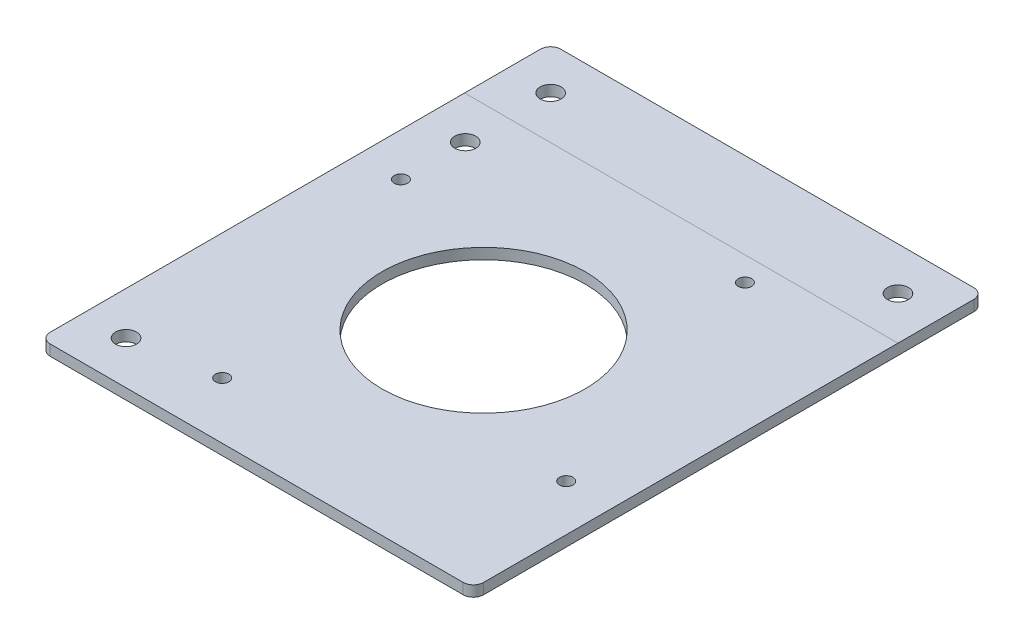
from build123d import *

# Parameters (mm, degrees)
SKETCH1_W           = 128
SKETCH1_H           = 150.8
SKETCH1_R           = 30
SKETCH1_R_2         = 3.1
BOSS_EXTRUDE1_DEPTH = 3.175
FILLET1_R           = 3
SKETCH3_R           = 1.985
CUT_EXTRUDE1_DEPTH  = 637.61018671


with BuildPart() as part:
    # Sketch1 → Boss-Extrude1 (new body)
    with BuildSketch(Plane(origin=(0, 0, 0), x_dir=(1, 0, 0), z_dir=(0, 1, 0))):
        with Locations((77.127334094, -545.362051651)):
            Rectangle(SKETCH1_W, SKETCH1_H)
        with Locations((76.627334094, -553.262051651)):
            Circle(SKETCH1_R, mode=Mode.SUBTRACT)
        with Locations((25.827334094, -482.662051651)):
            Circle(SKETCH1_R_2, mode=Mode.SUBTRACT)
        with Locations((128.427334094, -482.662051651)):
            Circle(SKETCH1_R_2, mode=Mode.SUBTRACT)
        with Locations((25.827334094, -608.062051651)):
            Circle(SKETCH1_R_2, mode=Mode.SUBTRACT)
        with Locations((25.827334094, -507.862051651)):
            Circle(SKETCH1_R_2, mode=Mode.SUBTRACT)
    extrude(amount=BOSS_EXTRUDE1_DEPTH)

    # Fillet1
    fillet1_edges = [part.edges().sort_by_distance(p)[0] for p in [
        (141.127334094, 1.5875, 469.962051651),
        (141.127334094, 1.5875, 620.762051651),
        (13.127334094, 1.5875, 620.762051651),
        (13.127334094, 1.5875, 469.962051651),
    ]]
    fillet(fillet1_edges, radius=FILLET1_R)

    # Sketch3 → Cut-Extrude1 (cut, through all)
    with BuildSketch(Plane(origin=(0, 3.175, 0), x_dir=(1, 0, 0), z_dir=(0, 1, 0))):
        with Locations((25.827334094, -526.868476675)):
            Circle(SKETCH3_R)
        with Locations((103.020909069, -502.462051651)):
            Circle(SKETCH3_R)
        with Locations((127.427334094, -579.655626627)):
            Circle(SKETCH3_R)
        with Locations((50.233759118, -604.062051651)):
            Circle(SKETCH3_R)
    extrude(amount=-CUT_EXTRUDE1_DEPTH, mode=Mode.SUBTRACT)


solid = part.part
